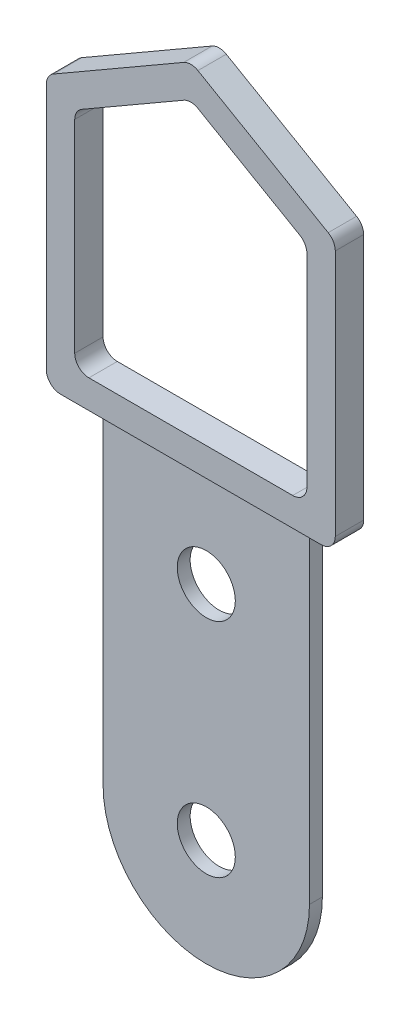
from build123d import *

# Parameters (mm, degrees)
EXTRUDE_1_DEPTH     = 2.2
SKETCH_4_W          = 16
SKETCH_4_H          = 33.8
CUT_EXTRUDE_1_DEPTH = 1.2
F_2_0MM_1_D         = 4.5
FILLET_1_R          = 1.1
FILLET_2_R          = 8
FILLET_3_R          = 1


with BuildPart() as part:
    # 草圖2 → 填料-伸長1 (new body)
    with BuildSketch(Plane.XY):
        with BuildLine():
            Line((8, -18), (8, 15.8))
            Line((8, 15.8), (11.2, 15.8))
            Line((11.2, 15.8), (11.2, 36.703847577))
            Line((11.2, 36.703847577), (0.55, 42.852627944))
            ThreePointArc((0.55, 42.852627944), (0, 43), (-0.55, 42.852627944))
            Line((-0.55, 42.852627944), (-11.2, 36.703847577))
            Line((-11.2, 36.703847577), (-11.2, 15.8))
            Line((-11.2, 15.8), (-8, 15.8))
            Line((-8, 15.8), (-8, -18))
            Line((-8, -18), (8, -18))
        make_face()
        Polygon((8, 18), (-8, 18), (-9, 18), (-9, 35.433676985), (0, 40.629829408), (9, 35.433676985), (9, 18), align=None, mode=Mode.SUBTRACT)
    extrude(amount=EXTRUDE_1_DEPTH)

    # 草圖4 → 除料-伸長1 (cut)
    with BuildSketch(Plane.XY.offset(2.2)):
        with Locations((0, -1.1)):
            Rectangle(SKETCH_4_W, SKETCH_4_H)
    extrude(amount=-CUT_EXTRUDE_1_DEPTH, mode=Mode.SUBTRACT)

    # Ø2.0mm 定位孔1 (through all)
    with Locations(Plane(origin=(0, 7.5, 1), x_dir=(1, 0, 0), z_dir=(0, 0, 1))):
        with Locations((0, 0), (0, -17.2)):
            Hole(F_2_0MM_1_D / 2)

    # 圓角1
    fillet_1_edges = [part.edges().sort_by_distance(p)[0] for p in [
        (9, 35.433676985, 1.1),
        (0, 40.629829408, 1.1),
        (-9, 35.433676985, 1.1),
        (-9, 18, 1.1),
        (9, 18, 1.1),
        (-11.2, 15.8, 1.1),
        (-11.2, 36.703847577, 1.1),
        (11.2, 36.703847577, 1.1),
        (11.2, 15.8, 1.1),
    ]]
    fillet(fillet_1_edges, radius=FILLET_1_R)

    # 圓角2
    fillet_2_edges = [part.edges().sort_by_distance(p)[0] for p in [
        (8, -18, 0.5),
        (-8, -18, 0.5),
    ]]
    fillet(fillet_2_edges, radius=FILLET_2_R - 0.0001)  # a hair under: the kernel refuses the full size

    # 圓角3
    fillet_3_edges = [part.edges().sort_by_distance(p)[0] for p in [
        (-8, 15.8, 0.5),
        (8, 15.8, 0.5),
    ]]
    fillet(fillet_3_edges, radius=FILLET_3_R)


solid = part.part
